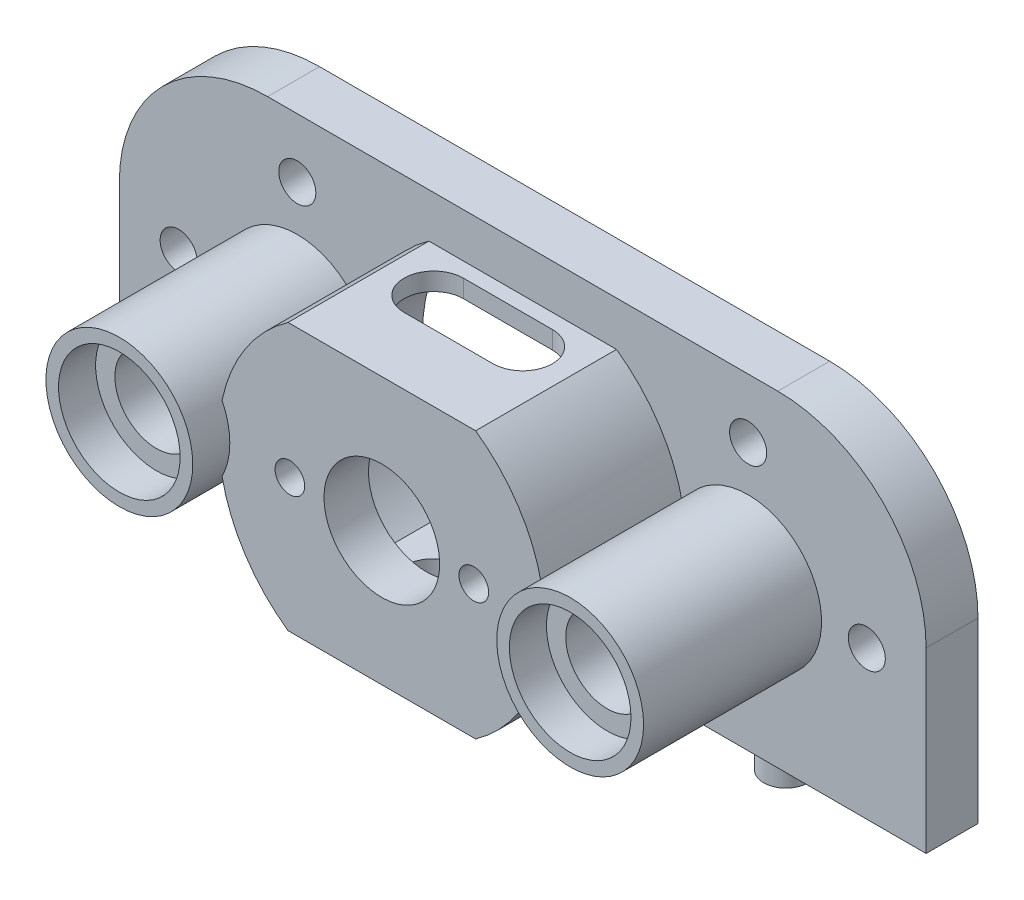
from build123d import *

# Parameters (mm, degrees)
SKETCH_2_R               = 3.9
SKETCH_2_R_2             = 4.1
SKETCH_2_R_3             = 1
SKETCH_2_R_4             = 1.25
EXTRUDE_1_DEPTH          = 3.5
SKETCH_2_4_R             = 4.1
SKETCH_2_4_R_2           = 2.8
EXTRUDE_2_DEPTH          = 1
CUT_EXTRUDE_1_DEPTH      = 41.636067723
CUT_EXTRUDE_1_DEPTH_BACK = 41.636067723
SKETCH_3_W               = 54.4
SKETCH_3_H               = 22
FILLET_1_R               = 10
CUT_EXTRUDE_2_DEPTH      = 36.158071619
CUT_EXTRUDE_2_DEPTH_BACK = 7
SKETCH_4_R               = 1
SKETCH_4_4_R             = 1.5
EXTRUDE_3_DEPTH          = 1.6
SKETCH_5_R               = 1
SKETCH_5_R_2             = 3.9
EXTRUDE_4_DEPTH          = 13
SKETCH_6_R               = 1
SKETCH_6_R_2             = 3.9
CUT_EXTRUDE_3_DEPTH      = 10
CUT_EXTRUDE_4_DEPTH      = 37.51301138
CUT_EXTRUDE_4_DEPTH_BACK = 37.51301138
SKETCH_2_5_R             = 4.1
SKETCH_2_5_R_2           = 2.8
EXTRUDE_5_DEPTH          = 13
SKETCH_8_R               = 4.1
EXTRUDE_6_DEPTH          = 12
EXTRUDE_START            = 9.5
EXTRUDE_7_DEPTH          = 2.5
SKETCH_2_6_R             = 4.1
SKETCH_2_6_R_2           = 2.8
CUT_EXTRUDE_10_DEPTH     = 2.5


# Read off the part's stored shape, not the designer's step: 凸台-拉伸7
with BuildPart() as part:
    # 草图2 → 凸台-拉伸1 (new body)
    with BuildSketch(Plane.XY):
        with BuildLine():
            Line((15.2, -20), (-15.2, -20))
            ThreePointArc((-15.2, -20), (-35.2, 0), (-15.2, 20))
            Line((-15.2, 20), (15.2, 20))
            ThreePointArc((15.2, 20), (35.2, 0), (15.2, -20))
        make_face()
        Circle(SKETCH_2_R, mode=Mode.SUBTRACT)
        with Locations((-15.2, 0)):
            Circle(SKETCH_2_R_2, mode=Mode.SUBTRACT)
        with Locations((15.2, 0)):
            Circle(SKETCH_2_R_2, mode=Mode.SUBTRACT)
        with Locations((-6.2, 0)):
            Circle(SKETCH_2_R_3, mode=Mode.SUBTRACT)
        with Locations((6.2, 0)):
            Circle(SKETCH_2_R_3, mode=Mode.SUBTRACT)
        with Locations((-15.2, 8)):
            Circle(SKETCH_2_R_4, mode=Mode.SUBTRACT)
        with Locations((-23.2, 0)):
            Circle(SKETCH_2_R_4, mode=Mode.SUBTRACT)
        with Locations((23.2, 0)):
            Circle(SKETCH_2_R_4, mode=Mode.SUBTRACT)
        with Locations((15.2, 8)):
            Circle(SKETCH_2_R_4, mode=Mode.SUBTRACT)
    extrude(amount=EXTRUDE_1_DEPTH)

    # 草图2<4> → 凸台-拉伸2 (add)
    # profile 1 of 2: a face of its own
    with BuildSketch(Plane.XY):
        with Locations((-15.2, 0)):
            Circle(SKETCH_2_4_R)
        with Locations((-15.2, 0)):
            Circle(SKETCH_2_4_R_2, mode=Mode.SUBTRACT)
    # profile 2 of 2: a face of its own
    with BuildSketch(Plane.XY):
        with Locations((15.2, 0)):
            Circle(SKETCH_2_4_R)
        with Locations((15.2, 0)):
            Circle(SKETCH_2_4_R_2, mode=Mode.SUBTRACT)
    extrude(amount=EXTRUDE_2_DEPTH)

    # 草图3 → 切除-拉伸1 (cut, two sides: drawn at the far end of the back side and taken through both)
    with BuildSketch(Plane.XY.offset(3.5).offset(-CUT_EXTRUDE_1_DEPTH_BACK)):
        with BuildLine():
            Line((15.2, -20), (-15.2, -20))
            ThreePointArc((-15.2, -20), (-35.2, 0), (-15.2, 20))
            Line((-15.2, 20), (15.2, 20))
            ThreePointArc((15.2, 20), (35.2, 0), (15.2, -20))
        make_face()
        with Locations((0, 1)):
            Rectangle(SKETCH_3_W, SKETCH_3_H, mode=Mode.SUBTRACT)
    extrude(amount=CUT_EXTRUDE_1_DEPTH + CUT_EXTRUDE_1_DEPTH_BACK, mode=Mode.SUBTRACT)

    # 圆角1
    fillet_1_edges = [part.edges().sort_by_distance(p)[0] for p in [
        (27.2, 12, 1.75),
        (-27.2, 12, 1.75),
    ]]
    fillet(fillet_1_edges, radius=FILLET_1_R)

    # 草图4 → 切除-拉伸2 (cut, two sides: drawn at the far end of the back side and taken through both)
    with BuildSketch(Plane.XZ.offset(10).offset(-CUT_EXTRUDE_2_DEPTH_BACK)):
        with Locations(Location((-24, 1.75, 0), (0, 0, 90))):
            Circle(SKETCH_4_R)
        with Locations(Location((24, 1.75, 0), (0, 0, 90))):
            Circle(SKETCH_4_R)
    extrude(amount=CUT_EXTRUDE_2_DEPTH + CUT_EXTRUDE_2_DEPTH_BACK, mode=Mode.SUBTRACT)

    # 草图4<4> → 凸台-拉伸3 (add)
    with BuildSketch(Plane.XZ.offset(10)):
        with Locations(Location((-16, 1.75, 0), (0, 0, 270))):
            Circle(SKETCH_4_4_R)
        with Locations(Location((16, 1.75, 0), (0, 0, 270))):
            Circle(SKETCH_4_4_R)
    extrude(amount=EXTRUDE_3_DEPTH)

    # 草图5 → 凸台-拉伸4 (add)
    with BuildSketch(Plane(origin=(0, 0, 0), x_dir=(-1, 0, 0), z_dir=(0, 0, -1))):
        with BuildLine():
            Line((6.32455532, 9), (-6.32455532, 9))
            ThreePointArc((-6.32455532, 9), (-11, 0), (-6.32455532, -9))
            Line((-6.32455532, -9), (6.32455532, -9))
            ThreePointArc((6.32455532, -9), (9.761406367, -5.070990607), (11, 0))
            ThreePointArc((11, 0), (9.761406367, 5.070990607), (6.32455532, 9))
        make_face()
        with Locations((-6.2, 0)):
            Circle(SKETCH_5_R, mode=Mode.SUBTRACT)
        Circle(SKETCH_5_R_2, mode=Mode.SUBTRACT)
        with Locations((6.2, 0)):
            Circle(SKETCH_5_R, mode=Mode.SUBTRACT)
    extrude(amount=-EXTRUDE_4_DEPTH)

    # 草图6 → 切除-拉伸3 (cut)
    with BuildSketch(Plane(origin=(0, 0, 0), x_dir=(-1, 0, 0), z_dir=(0, 0, -1))):
        with BuildLine():
            Line((6.65, 7.8), (-6.65, 7.8))
            ThreePointArc((-6.65, 7.8), (-10.25, 0), (-6.65, -7.8))
            Line((-6.65, -7.8), (6.65, -7.8))
            ThreePointArc((6.65, -7.8), (9.306583691, -4.295346319), (10.25, 0))
            ThreePointArc((10.25, 0), (9.306583691, 4.295346319), (6.65, 7.8))
        make_face()
        with Locations((-6.2, 0)):
            Circle(SKETCH_6_R, mode=Mode.SUBTRACT)
        Circle(SKETCH_6_R_2, mode=Mode.SUBTRACT)
        with Locations((6.2, 0)):
            Circle(SKETCH_6_R, mode=Mode.SUBTRACT)
    extrude(amount=-CUT_EXTRUDE_3_DEPTH, mode=Mode.SUBTRACT)

    # 草图7 → 切除-拉伸4 (cut, two sides: drawn at the far end of the back side and taken through both)
    with BuildSketch(Plane(origin=(0, 9, 0), x_dir=(1, 0, 0), z_dir=(0, 1, 0)).offset(-CUT_EXTRUDE_4_DEPTH_BACK)):
        with BuildLine():
            Line((-3, -4.5), (3, -4.5))
            ThreePointArc((3, -4.5), (5, -6.5), (3, -8.5))
            Line((3, -8.5), (-3, -8.5))
            ThreePointArc((-3, -8.5), (-5, -6.5), (-3, -4.5))
        make_face()
    extrude(amount=CUT_EXTRUDE_4_DEPTH + CUT_EXTRUDE_4_DEPTH_BACK, mode=Mode.SUBTRACT)

    # 草图2<5> → 凸台-拉伸5 (add)
    # profile 1 of 2: a face of its own
    with BuildSketch(Plane.XY):
        with Locations(Location((-15.2, 0, 0), (0, 0, 180))):
            Circle(SKETCH_2_5_R)
        with Locations((-15.2, 0)):
            Circle(SKETCH_2_5_R_2, mode=Mode.SUBTRACT)
    # profile 2 of 2: a face of its own
    with BuildSketch(Plane.XY):
        with Locations(Location((15.2, 0, 0), (0, 0, 180))):
            Circle(SKETCH_2_5_R)
        with Locations((15.2, 0)):
            Circle(SKETCH_2_5_R_2, mode=Mode.SUBTRACT)
    extrude(amount=EXTRUDE_5_DEPTH)

    # 草图8 → 凸台-拉伸6 (add)
    # profile 1 of 2: a face of its own
    with BuildSketch(Plane.XY.offset(3.5)):
        with BuildLine():
            ThreePointArc((-10.774259868, -2.217053064), (-11, 0), (-10.774259868, 2.217053064))
            ThreePointArc((-10.774259868, 2.217053064), (-20.15, 0), (-10.774259868, -2.217053064))
        make_face()
        with Locations((-15.2, 0)):
            Circle(SKETCH_8_R, mode=Mode.SUBTRACT)
    # profile 2 of 2: a face of its own
    with BuildSketch(Plane.XY.offset(3.5)):
        with BuildLine():
            ThreePointArc((10.774259868, -2.217053064), (16.339097526, -4.817152356), (20.15, 0))
            ThreePointArc((20.15, 0), (16.339097526, 4.817152356), (10.774259868, 2.217053064))
            ThreePointArc((10.774259868, 2.217053064), (11, 0), (10.774259868, -2.217053064))
        make_face()
        with Locations((15.2, 0)):
            Circle(SKETCH_8_R, mode=Mode.SUBTRACT)
    extrude(amount=EXTRUDE_6_DEPTH)

    # 凸台-拉伸7 outline → 凸台-拉伸7 (add)
    with BuildSketch(Plane.XY.offset(3.5).offset(EXTRUDE_START)):
        with BuildLine():
            ThreePointArc((-10.774259868, -2.217053064), (-10.25, 0), (-10.774259868, 2.217053064))
            ThreePointArc((-10.774259868, 2.217053064), (-11, 0), (-10.774259868, -2.217053064))
        make_face()
        with BuildLine():
            ThreePointArc((10.774259868, -2.217053064), (11, 0), (10.774259868, 2.217053064))
            ThreePointArc((10.774259868, 2.217053064), (10.25, 0), (10.774259868, -2.217053064))
        make_face()
    extrude(amount=EXTRUDE_7_DEPTH)

    # 草图2<6> → 切除-拉伸10 (cut)
    # profile 1 of 2: a face of its own
    with BuildSketch(Plane.XY):
        with Locations((-15.2, 0)):
            Circle(SKETCH_2_6_R)
        with Locations((-15.2, 0)):
            Circle(SKETCH_2_6_R_2, mode=Mode.SUBTRACT)
    # profile 2 of 2: a face of its own
    with BuildSketch(Plane.XY):
        with Locations((15.2, 0)):
            Circle(SKETCH_2_6_R)
        with Locations((15.2, 0)):
            Circle(SKETCH_2_6_R_2, mode=Mode.SUBTRACT)
    extrude(amount=CUT_EXTRUDE_10_DEPTH, mode=Mode.SUBTRACT)


solid = part.part
